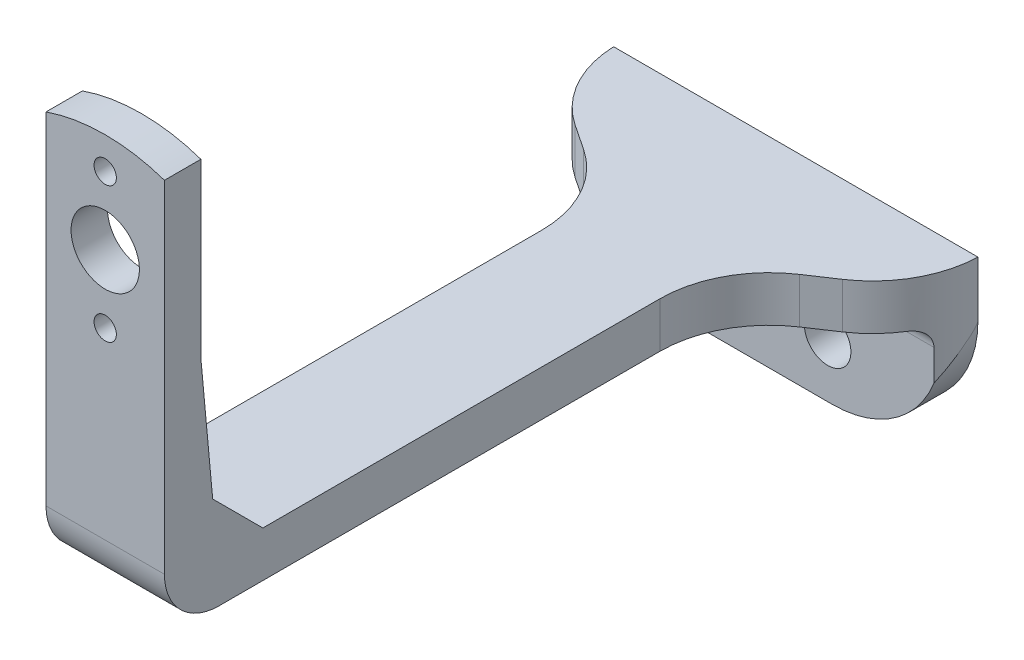
from build123d import *

# Parameters (mm, degrees)
CROQUIS2_R              = 2.55
CROQUIS2_R_2            = 3.75
CROQUIS2_R_3            = 1.225
SALIENTE_EXTRUIR1_DEPTH = 75.8075
CORTAR_EXTRUIR1_DEPTH   = 101.016875761
CROQUIS5_W              = 71.8075
CROQUIS5_H              = 13
CORTAR_EXTRUIR2_DEPTH   = 101.016875761
REDONDEO1_R             = 2
CHAFL_N1_SIZE           = 5
CHAFL_N1_SIZE2          = 5.533110727
REDONDEO2_R             = 12
CORTAR_EXTRUIR3_DEPTH   = 91.170863593
REDONDEO3_R             = 12
REDONDEO4_R             = 6


with BuildPart() as part:
    # Croquis2 → Saliente-Extruir1 (new body)
    with BuildSketch(Plane.XY):
        with BuildLine():
            Line((-20, 31.5422), (-20, -6))
            Line((-20, -6), (20, -6))
            Line((20, -6), (20, 31.5422))
            ThreePointArc((20, 31.5422), (14.142135624, 45.684335624), (0, 51.5422))
            ThreePointArc((0, 51.5422), (-14.142135624, 45.684335624), (-20, 31.5422))
        make_face()
        with Locations(Location((-7.5, 0, 0), (0, 0, 180))):
            Circle(CROQUIS2_R, mode=Mode.SUBTRACT)
        with Locations(Location((7.5, 0, 0), (0, 0, 180))):
            Circle(CROQUIS2_R, mode=Mode.SUBTRACT)
        with Locations(Location((0, 40.6, 0), (0, 0, 180))):
            Circle(CROQUIS2_R_2, mode=Mode.SUBTRACT)
        with Locations(Location((0, 48.0422, 0), (0, 0, 180))):
            Circle(CROQUIS2_R_3, mode=Mode.SUBTRACT)
        with Locations(Location((0, 33.1578, 0), (0, 0, 180))):
            Circle(CROQUIS2_R_3, mode=Mode.SUBTRACT)
    extrude(amount=SALIENTE_EXTRUIR1_DEPTH)

    # Croquis4 → Cortar-Extruir1 (cut, through all)
    with BuildSketch(Plane.ZY.offset(20)):
        Polygon((0, 12), (70, 12), (71.8075, 31.5422), (71.8075, 53.713147715), (0, 53.713147715), align=None)
    extrude(amount=-CORTAR_EXTRUIR1_DEPTH, mode=Mode.SUBTRACT)

    # Croquis5 → Cortar-Extruir2 (cut, through all)
    with BuildSketch(Plane.ZY.offset(20)):
        with Locations((39.90375, 0.5)):
            Rectangle(CROQUIS5_W, CROQUIS5_H)
    extrude(amount=-CORTAR_EXTRUIR2_DEPTH, mode=Mode.SUBTRACT)

    # Redondeo1
    redondeo1_edges = [part.edges().sort_by_distance(p)[0] for p in [
        (0, 7, 4),
    ]]
    fillet(redondeo1_edges, radius=REDONDEO1_R)

    # Chaflán1
    chafl_n1_edges = [part.edges().sort_by_distance(p)[0] for p in [
        (0, 12, 70),
    ]]
    chafl_n1_side = [part.faces().sort_by_distance(p)[0] for p in [
        (0, 12, 35),
    ]]
    chamfer(chafl_n1_edges, length=CHAFL_N1_SIZE, length2=CHAFL_N1_SIZE2, reference=chafl_n1_side[0])

    # Redondeo2
    redondeo2_edges = [part.edges().sort_by_distance(p)[0] for p in [
        (20, -6, 2),
        (-20, -6, 2),
    ]]
    fillet(redondeo2_edges, radius=REDONDEO2_R)

    # Croquis7 → Cortar-Extruir3 (cut, through all)
    with BuildSketch(Plane.XZ.offset(-7)):
        Polygon((-20, 6), (-6.5, 15), (-6.5, 75.8075), (-20, 75.8075), align=None)
        Polygon((20, 75.8075), (20, 6), (6.5, 15), (6.5, 75.8075), align=None)
    extrude(amount=-CORTAR_EXTRUIR3_DEPTH, mode=Mode.SUBTRACT)

    # Redondeo3
    # the kernel refuses this fillet: 12 mm, written as the material it adds along each edge
    with BuildSketch(Plane(origin=(-6.5, 7, 15), x_dir=(-0.8320502943378436, 0, -0.5547001962252291), z_dir=(0, 1, 0)), Plane(origin=(6.5, 7, 15), x_dir=(0, 0, 1), z_dir=(0, 1, 0))) as redondeo3_piece_1:
        with BuildLine():
            CenterArc((REDONDEO3_R * 0.535183758488, REDONDEO3_R), REDONDEO3_R, 213.690067526, 56.309932474)
            Line((-REDONDEO3_R * 0.29686653585, REDONDEO3_R * 0.445299803775), (0, 0))
            Line((0, 0), (REDONDEO3_R * 0.535183758488, 0))
        make_face()
    extrude(amount=5)
    # the kernel refuses this fillet: 12 mm, written as the material it takes off along each edge
    with BuildSketch(Plane(origin=(20, -9.032649504, 6), x_dir=(0, 0, -1), z_dir=(0, 1, 0))) as redondeo3_2_piece_1:
        with BuildLine():
            CenterArc((6.427278002, 11.99239065), REDONDEO3_R, 213.690067526, 54.269398965)
            Line((-3.55732553, 5.335988296), (0, 0))
            Line((0, 0), (6, 0))
        make_face()
    extrude(amount=37.065299008, mode=Mode.SUBTRACT)
    with BuildSketch(Plane(origin=(-20, -9.032649504, 6), x_dir=(0, 0, -1), z_dir=(0, 1, 0))) as redondeo3_2_piece_2:
        with BuildLine():
            CenterArc((6.427278002, -11.99239065), REDONDEO3_R, 92.040533509, 54.269398965)
            Line((-3.55732553, -5.335988296), (0, 0))
            Line((0, 0), (6, 0))
        make_face()
    extrude(amount=37.065299008, mode=Mode.SUBTRACT)

    # Redondeo4
    redondeo4_edges = [part.edges().sort_by_distance(p)[0] for p in [
        (0, 7, 75.8075),
    ]]
    fillet(redondeo4_edges, radius=REDONDEO4_R)


solid = part.part
